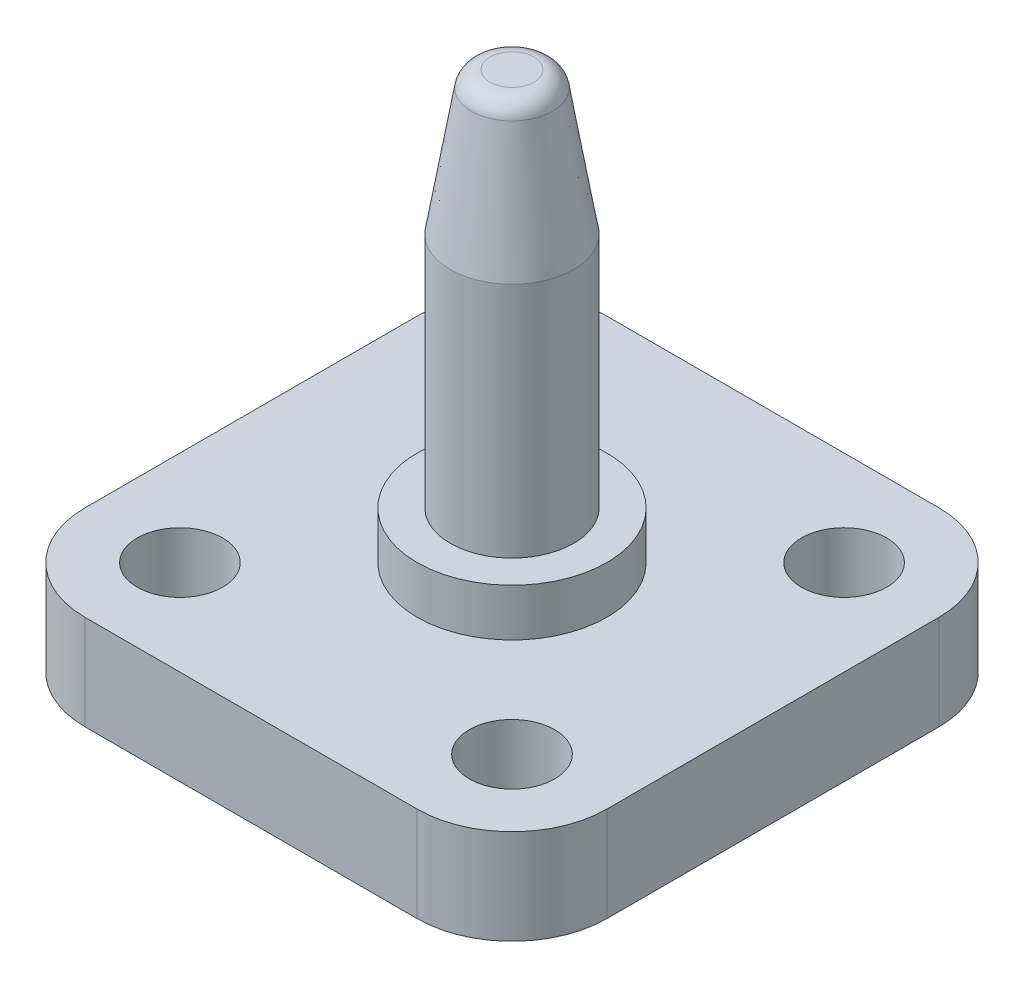
from build123d import *

# Parameters (mm, degrees)
BOSS_EXTRUDE1_DEPTH                        = 10
SKETCH3_R                                  = 4.5
CUT_EXTRUDE1_DEPTH                         = 60.476886267
MIRROR1_AT_THE_SECOND_PLANE_COPY_1_SKETC_R = 4.5
MIRROR1_AT_THE_SECOND_PLANE_COPY_1_DEPTH   = 60.476886267


with BuildPart() as part:
    # Sketch1 → Revolve1 (revolve)
    with BuildSketch(Plane.XY):
        with BuildLine():
            Line((0, 22.5), (2.305745823, 22.5))
            ThreePointArc((2.305745823, 22.5), (3.598495615, 22.026039965), (4.278533671, 20.828797975))
            Line((4.278533671, 20.828797975), (6.5, 7.5))
            Line((6.5, 7.5), (6.5, -17.5))
            Line((6.5, -17.5), (10, -17.5))
            Line((10, -17.5), (10, -22.5))
            Line((10, -22.5), (6.5, -22.5))
            Line((6.5, -22.5), (0, -22.5))
            Line((0, -22.5), (0, 22.5))
        make_face()
    revolve(axis=Axis((0, 22.5, 0), (0, -1, 0)))

    # Sketch2 → Boss-Extrude1 (add)
    with BuildSketch(Plane.XZ.offset(22.5)):
        with BuildLine():
            Line((17.5, 27.5), (-17.5, 27.5))
            ThreePointArc((-17.5, 27.5), (-24.571067812, 24.571067812), (-27.5, 17.5))
            Line((-27.5, 17.5), (-27.5, -17.5))
            ThreePointArc((-27.5, -17.5), (-24.571067812, -24.571067812), (-17.5, -27.5))
            Line((-17.5, -27.5), (17.5, -27.5))
            ThreePointArc((17.5, -27.5), (24.571067812, -24.571067812), (27.5, -17.5))
            Line((27.5, -17.5), (27.5, 17.5))
            ThreePointArc((27.5, 17.5), (24.571067812, 24.571067812), (17.5, 27.5))
        make_face()
    extrude(amount=BOSS_EXTRUDE1_DEPTH)

    # Sketch3 → Cut-Extrude1 (cut, through all)
    with BuildSketch(Plane(origin=(0, -22.5, 0), x_dir=(1, 0, 0), z_dir=(0, 1, 0))):
        with Locations((-17.5, 17.5)):
            Circle(SKETCH3_R)
    cut_extrude1 = extrude(amount=-CUT_EXTRUDE1_DEPTH, mode=Mode.SUBTRACT)

    # Mirror1: Cut-Extrude1 across plane
    add(cut_extrude1.mirror(Plane.XY), mode=Mode.SUBTRACT)

    # Mirror1 at the second plane: Cut-Extrude1 across plane
    add(cut_extrude1.mirror(Plane(origin=(0, 0, 0), x_dir=(0, 0, 1), z_dir=(1, 0, 0))), mode=Mode.SUBTRACT)

    # Mirror1 at the second plane copy 1 sketc → Mirror1 at the second plane copy 1 (cut, through all)
    with BuildSketch(Plane(origin=(0, -22.5, 0), x_dir=(-1, 0, 0), z_dir=(0, 1, 0))):
        with Locations((-17.5, 17.5)):
            Circle(MIRROR1_AT_THE_SECOND_PLANE_COPY_1_SKETC_R)
    extrude(amount=-MIRROR1_AT_THE_SECOND_PLANE_COPY_1_DEPTH, mode=Mode.SUBTRACT)


solid = part.part
